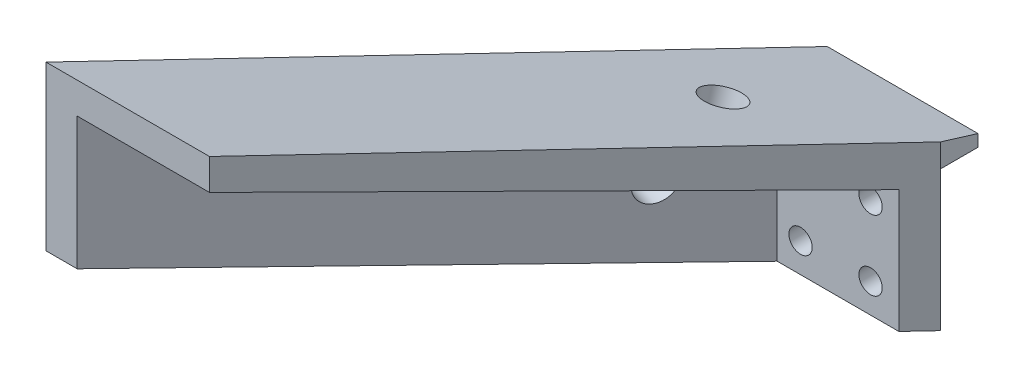
from build123d import *

# Parameters (mm, degrees)
SKETCH4_R             = 1.5
CUT_EXTRUDE1_DEPTH    = 85.285208987
CUT_LOFT1_START       = -30.432295628
CUT_LOFT1_DEPTH       = 40.932295728
CUT_LOFT1_START_2     = -9.276423483
CUT_LOFT1_2_DEPTH     = 37.189014281
CUT_LOFT1_START_3     = -30
CUT_LOFT1_3_OUTLINE_W = 25.432295628
CUT_LOFT1_3_OUTLINE_H = 72
CUT_LOFT1_3_DEPTH     = 19.959259101
CUT_LOFT1_START_4     = 10.040740899
CUT_LOFT1_4_OUTLINE_W = 25.432295628
CUT_LOFT1_4_OUTLINE_H = 72
CUT_LOFT1_4_DEPTH     = 16.959259101
SKETCH10_R            = 2.5
CUT_EXTRUDE2_DEPTH    = 10
SKETCH11_R            = 2.5
CUT_EXTRUDE3_DEPTH    = 10
BOSS_EXTRUDE1_DEPTH   = 4.8
SKETCH14_W            = 37.12113751
SKETCH14_H            = 26.161757616
CUT_EXTRUDE4_DEPTH    = 3
SKETCH15_W            = 15.761114721
SKETCH15_H            = 46.929857457
CUT_EXTRUDE5_DEPTH    = 3


with BuildPart() as part:
    # Loft1: read off the stored shape, not the designer's step
    # Loft1: loft between two sections, ruled curve by curve
    loft1_from = [
        Edge.make_line((-34.432295528, 31.912590798, 70), (-34.432295528, 10.912590798, 70)),
        Edge.make_line((-34.432295528, 10.912590798, 70), (-13.432295528, 10.912590798, 70)),
        Edge.make_line((-13.432295528, 10.912590798, 70), (-13.432295528, 31.912590798, 70)),
        Edge.make_line((-13.432295528, 31.912590798, 70), (-34.432295528, 31.912590798, 70)),
    ]
    loft1_to = [
        Edge.make_line((-10.5, 10.5, 0), (-10.5, -10.5, 0)),
        Edge.make_line((-10.5, -10.5, 0), (10.5, -10.5, 0)),
        Edge.make_line((10.5, -10.5, 0), (10.5, 10.5, 0)),
        Edge.make_line((10.5, 10.5, 0), (-10.5, 10.5, 0)),
    ]
    loft1 = Solid(Shell([*[Face.make_surface_from_curves(loft1_from[k], loft1_to[k]) for k in range(4)], Face(Wire(loft1_from)), Face(Wire(loft1_to))]))
    add(loft1)

    # Sketch4 → Cut-Extrude1 (cut, through all)
    with BuildSketch(Plane(origin=(0, 0, 0), x_dir=(-1, 0, 0), z_dir=(0, 0, -1))):
        with Locations((3.5, -5.5)):
            Circle(SKETCH4_R)
        with Locations((-5.5, -5.5)):
            Circle(SKETCH4_R)
        with Locations((-5.5, 3.5)):
            Circle(SKETCH4_R)
        with Locations((3.5, 3.5)):
            Circle(SKETCH4_R)
    extrude(amount=-CUT_EXTRUDE1_DEPTH, mode=Mode.SUBTRACT)

    # Cut-Loft1: read off the stored shape, not the designer's step
    # Cut-Loft1 outline → Cut-Loft1 (cut)
    with BuildSketch(Plane.YZ.offset(CUT_LOFT1_START)):
        Polygon((10.912590798, 70), (-9.276423383, 4), (6.5, 4), (27.912590798, 70), align=None)
    extrude(amount=CUT_LOFT1_DEPTH, mode=Mode.SUBTRACT)

    # Cut-Loft1 2 outline → Cut-Loft1 2 (add)
    with BuildSketch(Plane(origin=(0, 0, 0), x_dir=(1, 0, 0), z_dir=(0, 1, 0)).offset(CUT_LOFT1_START_2)):
        Polygon((-6.5, -4), (-11.867559744, -4), (-30.432295628, -58.300328622), (-30.432295628, -70), align=None)
    extrude(amount=CUT_LOFT1_2_DEPTH)

    # Cut-Loft1 3 outline → Cut-Loft1 3 (cut)
    with BuildSketch(Plane(origin=(0, 0, 0), x_dir=(1, 0, 0), z_dir=(0, 0.9562610380135655, -0.2925146614739479)).offset(CUT_LOFT1_START_3)):
        with Locations((-17.716147814, -36)):
            Rectangle(CUT_LOFT1_3_OUTLINE_W, CUT_LOFT1_3_OUTLINE_H)
    extrude(amount=CUT_LOFT1_3_DEPTH, mode=Mode.SUBTRACT)

    # Cut-Loft1 4 outline → Cut-Loft1 4 (cut)
    with BuildSketch(Plane(origin=(0, 0, 0), x_dir=(1, 0, 0), z_dir=(0, 0.9562610380135655, -0.2925146614739479)).offset(CUT_LOFT1_START_4)):
        with Locations((-17.716147814, -36)):
            Rectangle(CUT_LOFT1_4_OUTLINE_W, CUT_LOFT1_4_OUTLINE_H)
    extrude(amount=CUT_LOFT1_4_DEPTH, mode=Mode.SUBTRACT)

    # Sketch10 → Cut-Extrude2 (cut)
    with BuildSketch(Plane(origin=(0, 9.601569315, -2.937063925), x_dir=(1, 0, 0), z_dir=(0, 0.9562610380135655, -0.29251466147394767))):
        with Locations(Location((-4.504228797, -16.617876366, 0), (0, 0, 270))):
            Circle(SKETCH10_R)
    extrude(amount=-CUT_EXTRUDE2_DEPTH, mode=Mode.SUBTRACT)

    # Sketch11 → Cut-Extrude3 (cut)
    with BuildSketch(Plane(origin=(-9.401115557, 0, -3.214146797), x_dir=(-0.3235052723680801, 0, 0.9462263676045255), z_dir=(-0.9462263676045255, 0, -0.3235052723680801))):
        with Locations((18.022307071, 3.324420334)):
            Circle(SKETCH11_R)
    extrude(amount=-CUT_EXTRUDE3_DEPTH, mode=Mode.SUBTRACT)

    # Sketch13 → Boss-Extrude1 (add)
    with BuildSketch(Plane(origin=(0, 0, 0), x_dir=(-1, 0, 0), z_dir=(0, 0, -1))):
        Polygon((10.5, -10.5), (10.5, 10.5), (-10.5, 10.5), (-10.5, 7.5), (7.5, 7.5), (7.5, -10.5), align=None)
    extrude(amount=BOSS_EXTRUDE1_DEPTH)

    # Sketch14 → Cut-Extrude4 (cut)
    with BuildSketch(Plane(origin=(0, 9.601569315, -2.937063925), x_dir=(1, 0, 0), z_dir=(0, 0.9562610380135657, -0.2925146614739477))):
        with Locations((-1.808901269, 4.696953713)):
            Rectangle(SKETCH14_W, SKETCH14_H)
    extrude(amount=CUT_EXTRUDE4_DEPTH, mode=Mode.SUBTRACT)

    # Sketch15 → Cut-Extrude5 (cut)
    with BuildSketch(Plane(origin=(-9.401115557, 0, -3.214146797), x_dir=(-0.32350527236808013, 0, 0.9462263676045254), z_dir=(-0.9462263676045255, 0, -0.32350527236808013))):
        with Locations((3.08021958, -4.471111323)):
            Rectangle(SKETCH15_W, SKETCH15_H)
    extrude(amount=CUT_EXTRUDE5_DEPTH, mode=Mode.SUBTRACT)


solid = part.part
